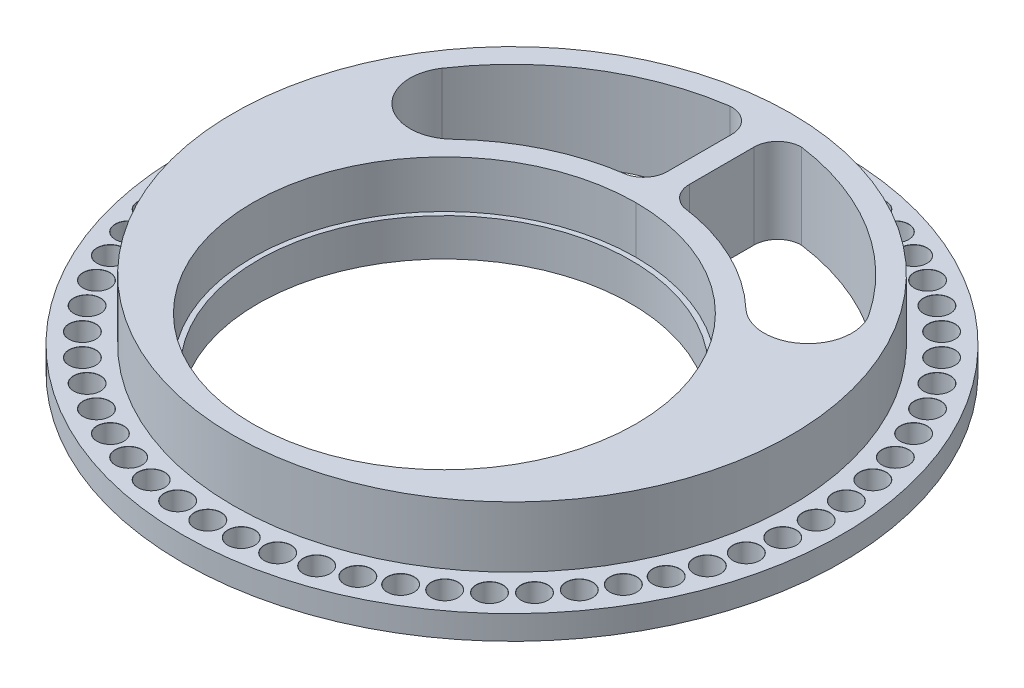
from build123d import *

# Parameters (mm, degrees)
SKETCH1_R                       = 35.052
BOSS_EXTRUDE1_DEPTH             = 4.5212
SKETCH3_R                       = 52.3875
BOSS_EXTRUDE2_DEPTH             = 11.43
SKETCH4_R                       = 35.052
CUT_EXTRUDE1_DEPTH              = 89.998629731
SKETCH9_R                       = 36.000000009
CUT_EXTRUDE3_DEPTH              = 8.89
F_5_0MM_DOWEL_HOLE1_D           = 5
F_5_0MM_DOWEL_HOLE1_CSINK_D     = 5.05
F_5_0MM_DOWEL_HOLE1_CSINK_ANGLE = 90
CIRPATTERN1_COUNT               = 60
CUT_EXTRUDE5_DEPTH              = 89.998629731
BOSS_EXTRUDE3_REACH             = 89.92
BOSS_EXTRUDE3_DIRECTION_2_REACH = 89.92


with BuildPart() as part:
    # Sketch1 → Boss-Extrude1 (new body)
    with BuildSketch(Plane(origin=(0, 0, 0), x_dir=(1, 0, 0), z_dir=(0, 1, 0))):
        with BuildLine():
            ThreePointArc((0, 61.9125), (-43.77874859, -43.77874859), (61.9125, 0))
            ThreePointArc((61.9125, 0), (43.77874859, 43.77874859), (0, 61.9125))
        make_face()
        with Locations((0, -12.7)):
            Circle(SKETCH1_R, mode=Mode.SUBTRACT)
    extrude(amount=BOSS_EXTRUDE1_DEPTH)

    # Sketch3 → Boss-Extrude2 (add)
    with BuildSketch(Plane(origin=(0, 4.5212, 0), x_dir=(1, 0, 0), z_dir=(0, 1, 0))):
        Circle(SKETCH3_R)
    extrude(amount=BOSS_EXTRUDE2_DEPTH)

    # Sketch4 → Cut-Extrude1 (cut, through all)
    with BuildSketch(Plane.XZ):
        with Locations((0, 12.7)):
            Circle(SKETCH4_R)
    extrude(amount=-CUT_EXTRUDE1_DEPTH, mode=Mode.SUBTRACT)

    # Sketch9 → Cut-Extrude3 (cut)
    with BuildSketch(Plane(origin=(0, 15.9512, 0), x_dir=(1, 0, 0), z_dir=(0, 1, 0))):
        with Locations((0, -12.7)):
            Circle(SKETCH9_R)
    extrude(amount=-CUT_EXTRUDE3_DEPTH, mode=Mode.SUBTRACT)

    # Ø5.0mm Dowel Hole1 (through all)
    with Locations(Plane(origin=(0, 4.5212, 0), x_dir=(1, 0, 0), z_dir=(0, 1, 0))):
        with Locations((0, 57.15)):
            f_5_0mm_dowel_hole1 = CounterSinkHole(F_5_0MM_DOWEL_HOLE1_D / 2, F_5_0MM_DOWEL_HOLE1_CSINK_D / 2, counter_sink_angle=F_5_0MM_DOWEL_HOLE1_CSINK_ANGLE)

    # CirPattern1: Ø5.0mm Dowel Hole1 ×60 about axis
    cirpattern1_axis = Axis((0, 15.9512, 0), (0, -1, 0))
    for i in range(1, CIRPATTERN1_COUNT):
        add(f_5_0mm_dowel_hole1.rotate(cirpattern1_axis, i * 360 / CIRPATTERN1_COUNT), mode=Mode.SUBTRACT)

    # Sketch10 → Cut-Extrude5 (cut, through all)
    with BuildSketch(Plane(origin=(0, 15.9512, 0), x_dir=(1, 0, 0), z_dir=(0, 1, 0))):
        with BuildLine():
            ThreePointArc((-27.568698422, 16.370448294), (0, 27.364000009), (27.568698422, 16.370448294))
            ThreePointArc((27.568698422, 16.370448294), (38.57955057, 16.056999754), (40.099152196, 26.966991775))
            ThreePointArc((40.099152196, 26.966991775), (0, 48.3235), (-40.099152196, 26.966991775))
            ThreePointArc((-40.099152196, 26.966991775), (-38.57955057, 16.056999754), (-27.568698422, 16.370448294))
        make_face()
    extrude(amount=-CUT_EXTRUDE5_DEPTH, mode=Mode.SUBTRACT)

    # Boss-Extrude3: up to this face of the body (flat: up to its plane)
    boss_extrude3_end = Plane(part.part.faces().sort_by_distance((-50.90575774, 15.9512, 0))[0])
    # Sketch15 → Boss-Extrude3 (add, up to the picked face)
    with BuildSketch(Plane(origin=(0, 7.9756, 0), x_dir=(1, 0, 0), z_dir=(0, 1, 0)), mode=Mode.PRIVATE) as boss_extrude3_sk1:
        with BuildLine():
            Line((-2.11713302, 43.39578959), (-2.11713302, 31.283478782))
            ThreePointArc((-2.11713302, 31.283478782), (-3.020045747, 28.598028587), (-5.361966653, 27.003569239))
            ThreePointArc((-5.361966653, 27.003569239), (-0.056014781, 27.363960851), (5.250924096, 27.018407481))
            ThreePointArc((5.250924096, 27.018407481), (2.926793499, 28.616259533), (2.032, 31.29096677))
            Line((2.032, 31.29096677), (2.032, 43.438919063))
            ThreePointArc((2.032, 43.438919063), (3.343379097, 46.591449005), (6.503741299, 47.883838624))
            ThreePointArc((6.503741299, 47.883838624), (-0.203176512, 48.32307287), (-6.906163701, 47.827456081))
            ThreePointArc((-6.906163701, 47.827456081), (-3.543125847, 46.658245825), (-2.11713302, 43.39578959))
        make_face()
    boss_extrude3_tool1 = split(extrude(boss_extrude3_sk1.sketch, amount=BOSS_EXTRUDE3_REACH, mode=Mode.PRIVATE), bisect_by=boss_extrude3_end, keep=Keep.BOTH, mode=Mode.PRIVATE)
    add(boss_extrude3_tool1.solids().sort_by(Axis((-0.049426, 7.9756, -38.213586), (0, 1, 0)))[0])

    # Boss-Extrude3 direction 2: up to this face of the body (flat: up to its plane)
    boss_extrude3_direction_2_end = Plane(part.part.faces().sort_by_distance((-60.161350056, 0, 0))[0])
    # Sketch15 → Boss-Extrude3 direction 2 (add, up to the picked face)
    with BuildSketch(Plane(origin=(0, 7.9756, 0), x_dir=(1, 0, 0), z_dir=(0, 1, 0)), mode=Mode.PRIVATE) as boss_extrude3_direction_2_sk1:
        with BuildLine():
            Line((-2.11713302, 43.39578959), (-2.11713302, 31.283478782))
            ThreePointArc((-2.11713302, 31.283478782), (-3.020045747, 28.598028587), (-5.361966653, 27.003569239))
            ThreePointArc((-5.361966653, 27.003569239), (-0.056014781, 27.363960851), (5.250924096, 27.018407481))
            ThreePointArc((5.250924096, 27.018407481), (2.926793499, 28.616259533), (2.032, 31.29096677))
            Line((2.032, 31.29096677), (2.032, 43.438919063))
            ThreePointArc((2.032, 43.438919063), (3.343379097, 46.591449005), (6.503741299, 47.883838624))
            ThreePointArc((6.503741299, 47.883838624), (-0.203176512, 48.32307287), (-6.906163701, 47.827456081))
            ThreePointArc((-6.906163701, 47.827456081), (-3.543125847, 46.658245825), (-2.11713302, 43.39578959))
        make_face()
    boss_extrude3_direction_2_tool1 = split(extrude(boss_extrude3_direction_2_sk1.sketch, amount=-BOSS_EXTRUDE3_DIRECTION_2_REACH, mode=Mode.PRIVATE), bisect_by=boss_extrude3_direction_2_end, keep=Keep.BOTH, mode=Mode.PRIVATE)
    add(boss_extrude3_direction_2_tool1.solids().sort_by(Axis((-0.049426, 7.9756, -38.213586), (0, -1, 0)))[0])


solid = part.part
